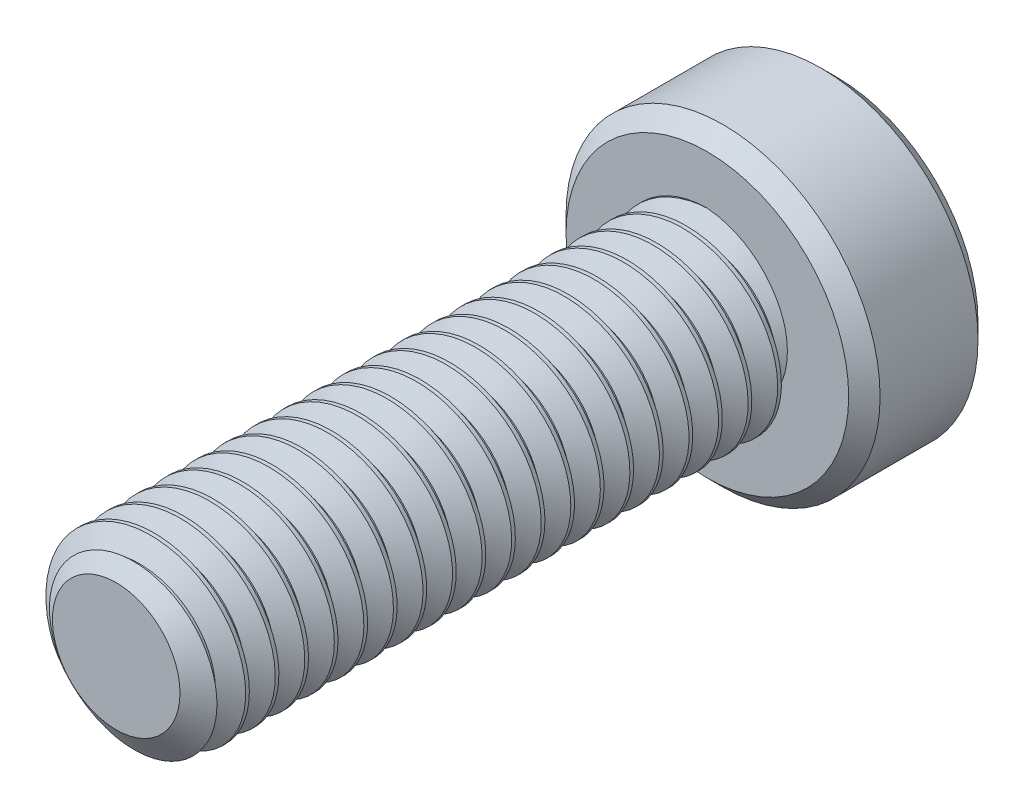
from build123d import *

# Parameters (mm, degrees)
SKETCH1_R          = 2.5
EXTRUDE1_DEPTH     = 16
CUT_SWEEP1_PITCH   = 0.8
SKETCH6_R          = 4.25
EXTRUDE2_DEPTH     = 3.5
CUT_EXTRUDE1_DEPTH = 2.25
CHAMFER1_SIZE      = 0.425


with BuildPart() as part:
    # Sketch1 → Extrude1 (new body)
    with BuildSketch(Plane.XY):
        Circle(SKETCH1_R)
    extrude(amount=-EXTRUDE1_DEPTH)

    # Cut-Sweep1: the profile of Sketch3 profile screwed along a right-hand helix of 21 turns, 6 arcs to a turn; built about Z, then put on its axis
    cut_sweep1_z = Axis((0, 0, 0), (0, 0, 1))
    cut_sweep1_corners = [(2.5003, 0, -0.700173205), (1.980384758, 0, -0.4), (1.980384758, 0, -0.3), (2.5003, 0, 0.000173205)]
    with BuildLine(mode=Mode.PRIVATE) as cut_sweep1_profile:
        Line(cut_sweep1_corners[0], cut_sweep1_corners[1])
        Line(cut_sweep1_corners[1], cut_sweep1_corners[2])
        Line(cut_sweep1_corners[2], cut_sweep1_corners[3])
        Line(cut_sweep1_corners[3], cut_sweep1_corners[0])
    cut_sweep1_cap = Face(cut_sweep1_profile.wire())
    cut_sweep1_turn_angles = [0, 30, 60, 90, 120, 150, 180, 210, 240, 270, 300, 330, 360]
    cut_sweep1_turn_weights = [1, 0.8660254037844387, 1, 0.8660254037844387, 1, 0.8660254037844387, 1, 0.8660254037844387, 1, 0.8660254037844387, 1, 0.8660254037844387, 1]
    cut_sweep1_turn_rails = [Edge.make_bspline([Vector(p[0], p[1], 0).rotate(cut_sweep1_z, cut_sweep1_turn_angles[k]) / cut_sweep1_turn_weights[k] + Vector(0, 0, p[2] + CUT_SWEEP1_PITCH * cut_sweep1_turn_angles[k] / 360) for k in range(13)], [0, 0, 0, 1, 1, 2, 2, 3, 3, 4, 4, 5, 5, 6, 6, 6], 2, cut_sweep1_turn_weights) for p in cut_sweep1_corners]
    cut_sweep1_turn_sides = [Face.make_surface_from_curves(cut_sweep1_turn_rails[p[0]], cut_sweep1_turn_rails[p[1]]) for p in [(0, 1), (1, 2), (2, 3), (3, 0)]]
    cut_sweep1 = Plane(origin=(0, 0, 0), x_dir=(0, 1, 0), z_dir=(0, 0, -1)) * Solid(Shell([*[p.moved(Location((0, 0, CUT_SWEEP1_PITCH * i))) for i in range(21) for p in cut_sweep1_turn_sides], cut_sweep1_cap, cut_sweep1_cap.rotate(cut_sweep1_z, 7560).moved(Location((0, 0, CUT_SWEEP1_PITCH * 7560 / 360)))]))
    add(cut_sweep1, mode=Mode.SUBTRACT)

    # Sketch4 → Cut-Revolve1 (revolve, cut)
    with BuildSketch(Plane(origin=(0, 0, 0), x_dir=(0, 0, -1), z_dir=(1, 0, 0)), mode=Mode.PRIVATE) as cut_revolve1_sk:
        Polygon((0.541691224, 2.5), (0, 1.726384758), (0, 2.5), align=None)
    revolve(cut_revolve1_sk.sketch.rotate(Axis((0, 0, 0), (0, 0, -1)), 260.43858876), axis=Axis((0, 0, 0), (0, 0, -1)), mode=Mode.SUBTRACT)

    # Sketch6 → Extrude2 (add)
    with BuildSketch(Plane(origin=(0, 0, -16), x_dir=(-1, 0, 0), z_dir=(0, 0, -1))):
        Circle(SKETCH6_R)
    extrude(amount=EXTRUDE2_DEPTH)

    # Sketch7 → Cut-Extrude1 (cut)
    with BuildSketch(Plane(origin=(0, 0, -19.5), x_dir=(-1, 0, 0), z_dir=(0, 0, -1))):
        Polygon((0, 1.732050808), (-1.5, 0.866025404), (-1.5, -0.866025404), (0, -1.732050808), (1.5, -0.866025404), (1.5, 0.866025404), align=None)
    extrude(amount=-CUT_EXTRUDE1_DEPTH, mode=Mode.SUBTRACT)

    # Cut-Extrude2 cone 1 section (through the dimple's axis) → Cut-Extrude2 (revolve, cut)
    with BuildSketch(Plane(origin=(0, 0, -19.5), x_dir=(0, 1, 0), z_dir=(1, 0, 0))):
        Polygon((0, 0), (1.732050808, 0), (0, 1.732050808), align=None)
    revolve(axis=Axis((0, 0, -19.5), (0, 0, 1)), mode=Mode.SUBTRACT)

    # Chamfer1
    chamfer1_edges = [part.edges().sort_by_distance(p)[0] for p in [
        (4.25, 0, -16),
        (4.25, 0, -19.5),
    ]]
    chamfer(chamfer1_edges, length=CHAMFER1_SIZE)


solid = part.part
